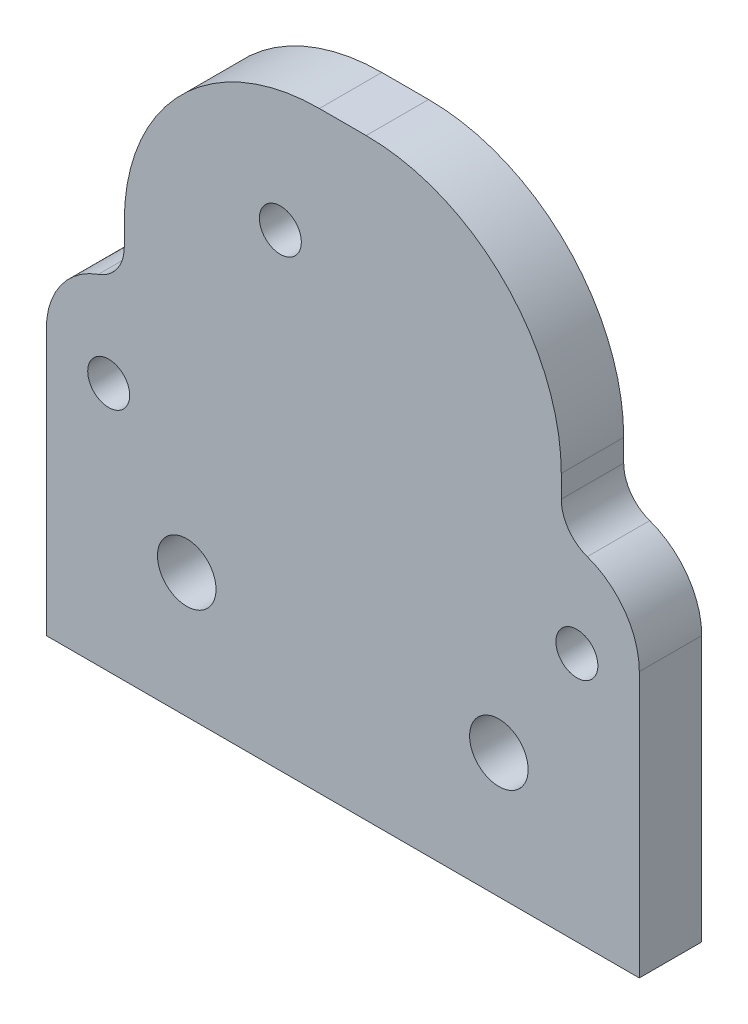
from build123d import *

# Parameters (mm, degrees)
SKETCH1_W           = 30.4
SKETCH1_H           = 3.2
BOSS_EXTRUDE1_DEPTH = 17.6
SKETCH2_R           = 1.5
CUT_EXTRUDE1_DEPTH  = 16
SKETCH3_R           = 1.075
CUT_EXTRUDE2_DEPTH  = 16
SKETCH4_W           = 22.4
SKETCH4_H           = 3.2
BOSS_EXTRUDE2_DEPTH = 12.8
SKETCH5_R           = 1.075
CUT_EXTRUDE3_DEPTH  = 16
FILLET1_R           = 10
FILLET2_R           = 4
FILLET3_R           = 2


with BuildPart() as part:
    # Sketch1 → Boss-Extrude1 (new body)
    with BuildSketch(Plane(origin=(0, 0, 0), x_dir=(1, 0, 0), z_dir=(0, 1, 0))):
        with Locations((15.2, -1.6)):
            Rectangle(SKETCH1_W, SKETCH1_H)
    extrude(amount=BOSS_EXTRUDE1_DEPTH)

    # Sketch2 → Cut-Extrude1 (cut)
    with BuildSketch(Plane.XY.offset(3.2)):
        with Locations((23.2, 6.4)):
            Circle(SKETCH2_R)
        with Locations((7.2, 6.4)):
            Circle(SKETCH2_R)
    extrude(amount=-CUT_EXTRUDE1_DEPTH, mode=Mode.SUBTRACT)

    # Sketch3 → Cut-Extrude2 (cut)
    with BuildSketch(Plane(origin=(0, 0, 0), x_dir=(-1, 0, 0), z_dir=(0, 0, -1))):
        with Locations((-27.2, 12.8)):
            Circle(SKETCH3_R)
        with Locations((-3.2, 12.8)):
            Circle(SKETCH3_R)
    extrude(amount=-CUT_EXTRUDE2_DEPTH, mode=Mode.SUBTRACT)

    # Sketch4 → Boss-Extrude2 (add)
    with BuildSketch(Plane(origin=(0, 17.6, 0), x_dir=(1, 0, 0), z_dir=(0, 1, 0))):
        with Locations((15.2, -1.6)):
            Rectangle(SKETCH4_W, SKETCH4_H)
    extrude(amount=BOSS_EXTRUDE2_DEPTH)

    # Sketch5 → Cut-Extrude3 (cut)
    with BuildSketch(Plane.XY.offset(3.2)):
        with Locations((12, 24)):
            Circle(SKETCH5_R)
    extrude(amount=-CUT_EXTRUDE3_DEPTH, mode=Mode.SUBTRACT)

    # Fillet1
    fillet1_edges = [part.edges().sort_by_distance(p)[0] for p in [
        (4, 30.4, 1.6),
        (26.4, 30.4, 1.6),
    ]]
    fillet(fillet1_edges, radius=FILLET1_R)

    # Fillet2
    fillet2_edges = [part.edges().sort_by_distance(p)[0] for p in [
        (30.4, 17.6, 1.6),
        (0, 17.6, 1.6),
    ]]
    fillet(fillet2_edges, radius=FILLET2_R - 0.0001)  # a hair under: the kernel refuses the full size

    # Fillet3
    fillet3_edges = [part.edges().sort_by_distance(p)[0] for p in [
        (4, 17.6, 1.6),
        (26.4, 17.6, 1.6),
    ]]
    fillet(fillet3_edges, radius=FILLET3_R)


solid = part.part
